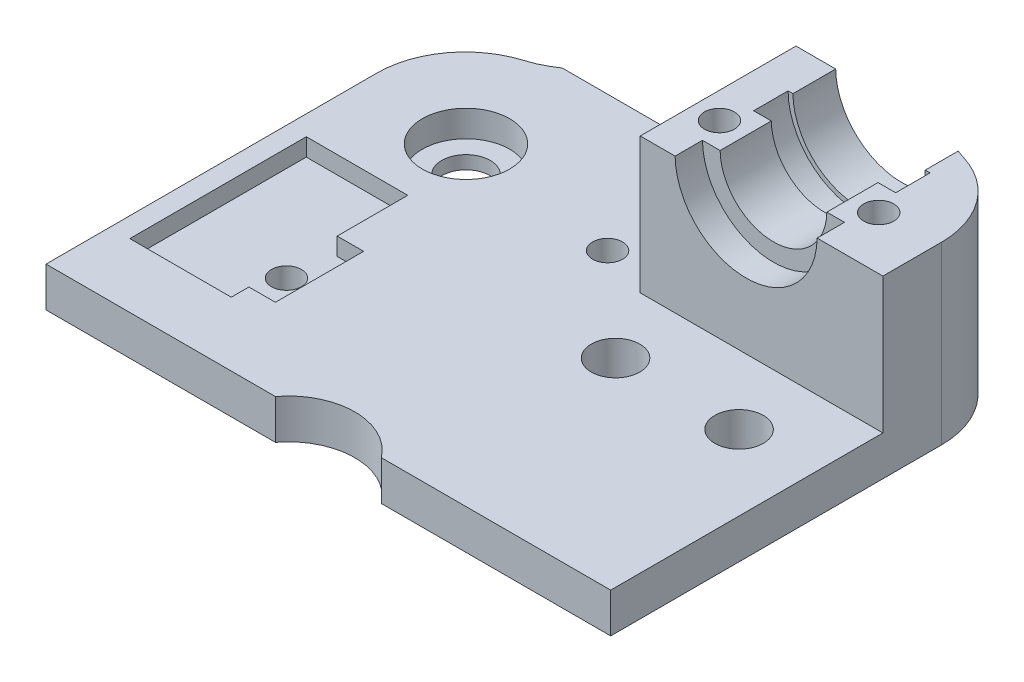
from build123d import *

# Parameters (mm, degrees)
SKETCH4_R           = 4.95
SKETCH4_R_2         = 2.75
SKETCH4_R_3         = 1.7
BOSS_EXTRUDE1_DEPTH = 4.5
BOSS_EXTRUDE2_START = 2.85
SKETCH4_2_R         = 4.95
BOSS_EXTRUDE2_DEPTH = 1.65
BOSS_EXTRUDE3_DEPTH = 15.5
CUT_EXTRUDE1_DEPTH  = 3.85
CUT_EXTRUDE2_START  = -3.85
SKETCH7_3_R         = 8.05
CUT_EXTRUDE2_DEPTH  = 3.9
CUT_EXTRUDE4_START  = -7.75
CUT_EXTRUDE4_DEPTH  = 5.8
CUT_EXTRUDE5_START  = -13.55
SKETCH7_5_R         = 8.05
CUT_EXTRUDE5_DEPTH  = 3.1
SKETCH8_W           = 24
SKETCH8_H           = 16.65
CUT_EXTRUDE6_DEPTH  = 0.1
SKETCH9_R           = 1.7
CUT_EXTRUDE7_DEPTH  = 83.1477938
SKETCH13_R          = 4.95
SKETCH13_R_2        = 2.75
BOSS_EXTRUDE5_DEPTH = 1.5
CUT_EXTRUDE12_START = -8
SKETCH14_R          = 1.7
CUT_EXTRUDE12_DEPTH = 8
CUT_EXTRUDE13_START = -8.2
CUT_EXTRUDE13_DEPTH = 0.2
CUT_EXTRUDE14_START = -8.4
CUT_EXTRUDE14_DEPTH = 0.2
BOSS_EXTRUDE6_DEPTH = 15.4
BOSS_EXTRUDE8_START = 1
BOSS_EXTRUDE8_DEPTH = 1
FILLET1_R           = 10
CUT_EXTRUDE15_START = -2
SKETCH18_R          = 1.7
SKETCH18_W          = 11.5
SKETCH18_H          = 20
CUT_EXTRUDE15_DEPTH = 2
CUT_EXTRUDE16_START = -4.85
SKETCH19_R          = 7.5
CUT_EXTRUDE16_DEPTH = 4.85


with BuildPart() as part:
    # Sketch4 → Boss-Extrude1 (new body)
    with BuildSketch(Plane(origin=(0, 0, 0), x_dir=(1, 0, 0), z_dir=(0, 1, 0))):
        with BuildLine():
            Line((0, 0), (26, 0))
            ThreePointArc((26, 0), (32, 3), (38, 0))
            Line((38, 0), (64, 0))
            Line((64, 0), (64, 37.5))
            ThreePointArc((64, 37.5), (61.071067812, 44.571067812), (54, 47.5))
            Line((54, 47.5), (10, 47.5))
            ThreePointArc((10, 47.5), (2.928932188, 44.571067812), (0, 37.5))
            Line((0, 37.5), (0, 0))
        make_face()
        with Locations(Location((12, 35.6, 0), (0, 0, 270))):
            Circle(SKETCH4_R, mode=Mode.SUBTRACT)
        with Locations(Location((52, 35.6, 0), (0, 0, 270))):
            Circle(SKETCH4_R, mode=Mode.SUBTRACT)
        with Locations(Location((41.5, 23.05, 0), (0, 0, 270))):
            Circle(SKETCH4_R_2, mode=Mode.SUBTRACT)
        with Locations(Location((55.5, 23.05, 0), (0, 0, 270))):
            Circle(SKETCH4_R_2, mode=Mode.SUBTRACT)
        with Locations(Location((13, 14.25, 0), (0, 0, 270))):
            Circle(SKETCH4_R_3, mode=Mode.SUBTRACT)
        with Locations(Location((30.5, 33.15, 0), (0, 0, 270))):
            Circle(SKETCH4_R_3, mode=Mode.SUBTRACT)
    extrude(amount=BOSS_EXTRUDE1_DEPTH)

    # Sketch4<2> → Boss-Extrude2 (add)
    with BuildSketch(Plane(origin=(0, 0, 0), x_dir=(1, 0, 0), z_dir=(0, 1, 0)).offset(BOSS_EXTRUDE2_START)):
        with Locations(Location((52, 35.6, 0), (0, 0, 270))):
            Circle(SKETCH4_2_R)
    extrude(amount=BOSS_EXTRUDE2_DEPTH)

    # Sketch6 → Boss-Extrude3 (add)
    with BuildSketch(Plane(origin=(0, 4.5, 0), x_dir=(1, 0, 0), z_dir=(0, 1, 0))):
        with BuildLine():
            Line((36.5, 47.5), (54, 47.5))
            ThreePointArc((54, 47.5), (57.464576398, 46.880656181), (60.5, 45.099342077))
            Line((60.5, 45.099342077), (60.5, 30.85))
            Line((60.5, 30.85), (36.5, 30.85))
            Line((36.5, 30.85), (36.5, 47.5))
        make_face()
    extrude(amount=BOSS_EXTRUDE3_DEPTH)

    # Sketch7 → Cut-Extrude1 (cut)
    with BuildSketch(Plane(origin=(0, 0, -47.5), x_dir=(-1, 0, 0), z_dir=(0, 0, -1))):
        with BuildLine():
            Line((-42.45, 20), (-54, 20))
            Line((-54, 20), (-54, 17.479583368))
            ThreePointArc((-54, 17.479583368), (-47.210135666, 14.089099053), (-42.45, 20))
        make_face()
        with BuildLine():
            Line((-54, 17.479583368), (-54, 20))
            Line((-54, 20), (-54.55, 20))
            ThreePointArc((-54.55, 20), (-54.410900947, 18.710135666), (-54, 17.479583368))
        make_face()
        with BuildLine():
            Line((-42.45, 20), (-54, 20))
            Line((-54, 20), (-54, 17.479583368))
            ThreePointArc((-54, 17.479583368), (-47.210135666, 14.089099053), (-42.45, 20))
        make_face()
    extrude(amount=-CUT_EXTRUDE1_DEPTH, mode=Mode.SUBTRACT)

    # Sketch7<3> → Cut-Extrude2 (cut)
    with BuildSketch(Plane(origin=(0, 0, -47.5), x_dir=(-1, 0, 0), z_dir=(0, 0, -1)).offset(CUT_EXTRUDE2_START)):
        with Locations((-48.5, 20)):
            Circle(SKETCH7_3_R)
    extrude(amount=-CUT_EXTRUDE2_DEPTH, mode=Mode.SUBTRACT)

    # Sketch7<4> → Cut-Extrude4 (cut)
    with BuildSketch(Plane(origin=(0, 0, -47.5), x_dir=(-1, 0, 0), z_dir=(0, 0, -1)).offset(CUT_EXTRUDE4_START)):
        with BuildLine():
            Line((-42.45, 20), (-54, 20))
            Line((-54, 20), (-54, 17.479583368))
            ThreePointArc((-54, 17.479583368), (-47.210135666, 14.089099053), (-42.45, 20))
        make_face()
        with BuildLine():
            Line((-54, 17.479583368), (-54, 20))
            Line((-54, 20), (-54.55, 20))
            ThreePointArc((-54.55, 20), (-54.410900947, 18.710135666), (-54, 17.479583368))
        make_face()
        with BuildLine():
            Line((-42.45, 20), (-54, 20))
            Line((-54, 20), (-54, 17.479583368))
            ThreePointArc((-54, 17.479583368), (-47.210135666, 14.089099053), (-42.45, 20))
        make_face()
    extrude(amount=-CUT_EXTRUDE4_DEPTH, mode=Mode.SUBTRACT)

    # Sketch7<5> → Cut-Extrude5 (cut)
    with BuildSketch(Plane(origin=(0, 0, -47.5), x_dir=(-1, 0, 0), z_dir=(0, 0, -1)).offset(CUT_EXTRUDE5_START)):
        with Locations((-48.5, 20)):
            Circle(SKETCH7_5_R)
    extrude(amount=-CUT_EXTRUDE5_DEPTH, mode=Mode.SUBTRACT)

    # Sketch8 → Cut-Extrude6 (cut)
    with BuildSketch(Plane(origin=(0, 20, 0), x_dir=(1, 0, 0), z_dir=(0, 1, 0))):
        with Locations((48.5, 39.175)):
            Rectangle(SKETCH8_W, SKETCH8_H)
    extrude(amount=-CUT_EXTRUDE6_DEPTH, mode=Mode.SUBTRACT)

    # Sketch9 → Cut-Extrude7 (cut, through all)
    with BuildSketch(Plane(origin=(0, 19.9, 0), x_dir=(1, 0, 0), z_dir=(0, 1, 0))):
        with Locations(Location((39.475413251, 36.85, 0), (0, 0, 270))):
            Circle(SKETCH9_R)
        with Locations(Location((57.524586749, 36.85, 0), (0, 0, 270))):
            Circle(SKETCH9_R)
    extrude(amount=-CUT_EXTRUDE7_DEPTH, mode=Mode.SUBTRACT)

    # Sketch13 → Boss-Extrude5 (add)
    with BuildSketch(Plane.XZ):
        with Locations(Location((12, -35.6, 0), (0, 0, 270))):
            Circle(SKETCH13_R)
        with Locations(Location((12, -35.6, 0), (0, 0, 270))):
            Circle(SKETCH13_R_2, mode=Mode.SUBTRACT)
    extrude(amount=-BOSS_EXTRUDE5_DEPTH)

    # Sketch14 → Cut-Extrude12 (cut)
    with BuildSketch(Plane.XZ.offset(CUT_EXTRUDE12_START)):
        with Locations(Location((39.475413251, -36.85, 0), (0, 0, 90))):
            Circle(SKETCH14_R)
        Polygon((41.175413251, -35.15), (41.175413251, -34.656068977), (39.475413251, -33.674573519), (37.775413251, -34.656068977), (37.775413251, -35.15), (39.475413251, -35.15), align=None)
        with BuildLine():
            Line((41.175413251, -36.85), (41.175413251, -35.15))
            Line((41.175413251, -35.15), (39.475413251, -35.15))
            ThreePointArc((39.475413251, -35.15), (40.677494779, -35.647918472), (41.175413251, -36.85))
        make_face()
        Polygon((41.175413251, -35.15), (42.030926879, -35.15), (41.175413251, -34.656068977), align=None)
        Polygon((42.030926879, -38.55), (42.225413251, -38.43771324), (42.225413251, -35.26228676), (42.030926879, -35.15), (41.175413251, -35.15), (41.175413251, -36.85), (41.175413251, -38.55), align=None)
        Polygon((41.175413251, -39.043931023), (42.030926879, -38.55), (41.175413251, -38.55), align=None)
        Polygon((39.475413251, -40.025426481), (41.175413251, -39.043931023), (41.175413251, -38.55), (39.475413251, -38.55), (37.775413251, -38.55), (37.775413251, -39.043931023), align=None)
        with BuildLine():
            Line((39.475413251, -38.55), (41.175413251, -38.55))
            Line((41.175413251, -38.55), (41.175413251, -36.85))
            ThreePointArc((41.175413251, -36.85), (40.677494779, -38.052081528), (39.475413251, -38.55))
        make_face()
        with BuildLine():
            Line((37.775413251, -38.55), (39.475413251, -38.55))
            ThreePointArc((39.475413251, -38.55), (38.273331723, -38.052081528), (37.775413251, -36.85))
            Line((37.775413251, -36.85), (37.775413251, -38.55))
        make_face()
        Polygon((36.919899624, -38.55), (37.775413251, -39.043931023), (37.775413251, -38.55), align=None)
        Polygon((36.919899624, -38.55), (37.775413251, -38.55), (37.775413251, -36.85), (37.775413251, -35.15), (36.919899624, -35.15), (36.725413251, -35.26228676), (36.725413251, -38.43771324), align=None)
        Polygon((37.775413251, -35.15), (37.775413251, -34.656068977), (36.919899624, -35.15), align=None)
        with BuildLine():
            ThreePointArc((37.775413251, -36.85), (38.273331723, -35.647918472), (39.475413251, -35.15))
            Line((39.475413251, -35.15), (37.775413251, -35.15))
            Line((37.775413251, -35.15), (37.775413251, -36.85))
        make_face()
        with BuildLine():
            Line((57.524586749, -40.025426481), (59.224586749, -39.043931023))
            Line((59.224586749, -39.043931023), (59.224586749, -38.55))
            Line((59.224586749, -38.55), (57.524586749, -38.55))
            Line((57.524586749, -38.55), (55.974921383, -38.55))
            ThreePointArc((55.974921383, -38.55), (55.90094113, -38.647155772), (55.824586749, -38.742457033))
            Line((55.824586749, -38.742457033), (55.824586749, -39.043931023))
            Line((55.824586749, -39.043931023), (57.524586749, -40.025426481))
        make_face()
        Polygon((59.224586749, -39.043931023), (60.080100376, -38.55), (59.224586749, -38.55), align=None)
        Polygon((60.080100376, -38.55), (60.274586749, -38.43771324), (60.274586749, -35.26228676), (60.080100376, -35.15), (59.224586749, -35.15), (59.224586749, -36.85), (59.224586749, -38.55), align=None)
        with BuildLine():
            Line((57.524586749, -38.55), (59.224586749, -38.55))
            Line((59.224586749, -38.55), (59.224586749, -36.85))
            ThreePointArc((59.224586749, -36.85), (58.726668277, -38.052081528), (57.524586749, -38.55))
        make_face()
        with BuildLine():
            Line((55.974921383, -38.55), (57.524586749, -38.55))
            ThreePointArc((57.524586749, -38.55), (56.864634759, -38.416672707), (56.308199961, -38.037603967))
            ThreePointArc((56.308199961, -38.037603967), (56.149477343, -38.298951237), (55.974921383, -38.55))
        make_face()
        with BuildLine():
            ThreePointArc((57.524586749, -38.55), (58.726668277, -38.052081528), (59.224586749, -36.85))
            ThreePointArc((59.224586749, -36.85), (58.726668283, -35.647918478), (57.524586766, -35.15))
            ThreePointArc((57.524586766, -35.15), (57.226643414, -35.176312523), (56.937923169, -35.254435572))
            ThreePointArc((56.937923169, -35.254435572), (56.933989419, -35.202195507), (56.929503018, -35.15))
            Line((56.929503018, -35.15), (55.824586749, -35.15))
            Line((55.824586749, -35.15), (55.824586749, -38.55))
            Line((55.824586749, -38.55), (55.974921383, -38.55))
            ThreePointArc((55.974921383, -38.55), (56.149477343, -38.298951237), (56.308199961, -38.037603967))
            ThreePointArc((56.308199961, -38.037603967), (56.864634759, -38.416672707), (57.524586749, -38.55))
        make_face()
        with BuildLine():
            ThreePointArc((55.824586749, -38.742457033), (55.90094113, -38.647155772), (55.974921383, -38.55))
            Line((55.974921383, -38.55), (55.824586749, -38.55))
            Line((55.824586749, -38.55), (55.824586749, -38.742457033))
        make_face()
        with BuildLine():
            Line((54.969073121, -38.55), (55.650309982, -38.943312285))
            ThreePointArc((55.650309982, -38.943312285), (55.738797399, -38.84405518), (55.824586749, -38.742457033))
            Line((55.824586749, -38.742457033), (55.824586749, -38.55))
            Line((55.824586749, -38.55), (54.969073121, -38.55))
        make_face()
        Polygon((54.969073121, -38.55), (55.824586749, -38.55), (55.824586749, -35.15), (54.969073121, -35.15), (54.774586749, -35.26228676), (54.774586749, -38.43771324), align=None)
        Polygon((55.824586749, -35.15), (55.824586749, -34.656068977), (54.969073121, -35.15), align=None)
        with BuildLine():
            ThreePointArc((56.929503018, -35.15), (56.855411043, -34.636940496), (56.728069624, -34.134442896))
            Line((56.728069624, -34.134442896), (55.824586749, -34.656068977))
            Line((55.824586749, -34.656068977), (55.824586749, -35.15))
            Line((55.824586749, -35.15), (56.929503018, -35.15))
        make_face()
        with BuildLine():
            ThreePointArc((56.937923169, -35.254435572), (57.226643414, -35.176312523), (57.524586766, -35.15))
            Line((57.524586766, -35.15), (56.929503018, -35.15))
            ThreePointArc((56.929503018, -35.15), (56.933989419, -35.202195507), (56.937923169, -35.254435572))
        make_face()
        with BuildLine():
            Line((59.224586749, -35.15), (59.224586749, -34.656068977))
            Line((59.224586749, -34.656068977), (57.524586749, -33.674573519))
            Line((57.524586749, -33.674573519), (56.728069624, -34.134442896))
            ThreePointArc((56.728069624, -34.134442896), (56.855411043, -34.636940496), (56.929503018, -35.15))
            Line((56.929503018, -35.15), (57.524586766, -35.15))
            Line((57.524586766, -35.15), (59.224586749, -35.15))
        make_face()
        with BuildLine():
            Line((59.224586749, -36.85), (59.224586749, -35.15))
            Line((59.224586749, -35.15), (57.524586766, -35.15))
            ThreePointArc((57.524586766, -35.15), (58.726668283, -35.647918478), (59.224586749, -36.85))
        make_face()
        Polygon((59.224586749, -35.15), (60.080100376, -35.15), (59.224586749, -34.656068977), align=None)
        with BuildLine():
            Line((55.650309982, -38.943312285), (55.824586749, -39.043931023))
            Line((55.824586749, -39.043931023), (55.824586749, -38.742457033))
            ThreePointArc((55.824586749, -38.742457033), (55.738797399, -38.84405518), (55.650309982, -38.943312285))
        make_face()
    extrude(amount=CUT_EXTRUDE12_DEPTH, mode=Mode.SUBTRACT)

    # Sketch14<3> → Cut-Extrude13 (cut)
    with BuildSketch(Plane.XZ.offset(CUT_EXTRUDE13_START)):
        Polygon((36.919899624, -38.55), (37.775413251, -38.55), (37.775413251, -36.85), (37.775413251, -35.15), (36.919899624, -35.15), (36.725413251, -35.26228676), (36.725413251, -38.43771324), align=None)
        with BuildLine():
            ThreePointArc((37.775413251, -36.85), (38.273331723, -35.647918472), (39.475413251, -35.15))
            Line((39.475413251, -35.15), (37.775413251, -35.15))
            Line((37.775413251, -35.15), (37.775413251, -36.85))
        make_face()
        with BuildLine():
            Line((41.175413251, -36.85), (41.175413251, -35.15))
            Line((41.175413251, -35.15), (39.475413251, -35.15))
            ThreePointArc((39.475413251, -35.15), (40.677494779, -35.647918472), (41.175413251, -36.85))
        make_face()
        Polygon((42.030926879, -38.55), (42.225413251, -38.43771324), (42.225413251, -35.26228676), (42.030926879, -35.15), (41.175413251, -35.15), (41.175413251, -36.85), (41.175413251, -38.55), align=None)
        with BuildLine():
            Line((39.475413251, -38.55), (41.175413251, -38.55))
            Line((41.175413251, -38.55), (41.175413251, -36.85))
            ThreePointArc((41.175413251, -36.85), (40.677494779, -38.052081528), (39.475413251, -38.55))
        make_face()
        with BuildLine():
            Line((37.775413251, -38.55), (39.475413251, -38.55))
            ThreePointArc((39.475413251, -38.55), (38.273331723, -38.052081528), (37.775413251, -36.85))
            Line((37.775413251, -36.85), (37.775413251, -38.55))
        make_face()
        Polygon((54.969073121, -38.55), (55.824586749, -38.55), (55.824586749, -35.15), (54.969073121, -35.15), (54.774586749, -35.26228676), (54.774586749, -38.43771324), align=None)
        with BuildLine():
            ThreePointArc((57.524586749, -38.55), (58.726668277, -38.052081528), (59.224586749, -36.85))
            ThreePointArc((59.224586749, -36.85), (58.726668283, -35.647918478), (57.524586766, -35.15))
            ThreePointArc((57.524586766, -35.15), (57.226643414, -35.176312523), (56.937923169, -35.254435572))
            ThreePointArc((56.937923169, -35.254435572), (56.933989419, -35.202195507), (56.929503018, -35.15))
            Line((56.929503018, -35.15), (55.824586749, -35.15))
            Line((55.824586749, -35.15), (55.824586749, -38.55))
            Line((55.824586749, -38.55), (55.974921383, -38.55))
            ThreePointArc((55.974921383, -38.55), (56.149477343, -38.298951237), (56.308199961, -38.037603967))
            ThreePointArc((56.308199961, -38.037603967), (56.864634759, -38.416672707), (57.524586749, -38.55))
        make_face()
        with BuildLine():
            ThreePointArc((56.937923169, -35.254435572), (57.226643414, -35.176312523), (57.524586766, -35.15))
            Line((57.524586766, -35.15), (56.929503018, -35.15))
            ThreePointArc((56.929503018, -35.15), (56.933989419, -35.202195507), (56.937923169, -35.254435572))
        make_face()
        with BuildLine():
            Line((59.224586749, -36.85), (59.224586749, -35.15))
            Line((59.224586749, -35.15), (57.524586766, -35.15))
            ThreePointArc((57.524586766, -35.15), (58.726668283, -35.647918478), (59.224586749, -36.85))
        make_face()
        with BuildLine():
            Line((57.524586749, -38.55), (59.224586749, -38.55))
            Line((59.224586749, -38.55), (59.224586749, -36.85))
            ThreePointArc((59.224586749, -36.85), (58.726668277, -38.052081528), (57.524586749, -38.55))
        make_face()
        with BuildLine():
            Line((55.974921383, -38.55), (57.524586749, -38.55))
            ThreePointArc((57.524586749, -38.55), (56.864634759, -38.416672707), (56.308199961, -38.037603967))
            ThreePointArc((56.308199961, -38.037603967), (56.149477343, -38.298951237), (55.974921383, -38.55))
        make_face()
        Polygon((60.080100376, -38.55), (60.274586749, -38.43771324), (60.274586749, -35.26228676), (60.080100376, -35.15), (59.224586749, -35.15), (59.224586749, -36.85), (59.224586749, -38.55), align=None)
    extrude(amount=CUT_EXTRUDE13_DEPTH, mode=Mode.SUBTRACT)

    # Sketch14<4> → Cut-Extrude14 (cut)
    with BuildSketch(Plane.XZ.offset(CUT_EXTRUDE14_START)):
        Polygon((41.175413251, -35.15), (41.175413251, -34.656068977), (39.475413251, -33.674573519), (37.775413251, -34.656068977), (37.775413251, -35.15), (39.475413251, -35.15), align=None)
        with BuildLine():
            ThreePointArc((37.775413251, -36.85), (38.273331723, -35.647918472), (39.475413251, -35.15))
            Line((39.475413251, -35.15), (37.775413251, -35.15))
            Line((37.775413251, -35.15), (37.775413251, -36.85))
        make_face()
        with BuildLine():
            Line((41.175413251, -36.85), (41.175413251, -35.15))
            Line((41.175413251, -35.15), (39.475413251, -35.15))
            ThreePointArc((39.475413251, -35.15), (40.677494779, -35.647918472), (41.175413251, -36.85))
        make_face()
        with BuildLine():
            Line((39.475413251, -38.55), (41.175413251, -38.55))
            Line((41.175413251, -38.55), (41.175413251, -36.85))
            ThreePointArc((41.175413251, -36.85), (40.677494779, -38.052081528), (39.475413251, -38.55))
        make_face()
        with BuildLine():
            Line((37.775413251, -38.55), (39.475413251, -38.55))
            ThreePointArc((39.475413251, -38.55), (38.273331723, -38.052081528), (37.775413251, -36.85))
            Line((37.775413251, -36.85), (37.775413251, -38.55))
        make_face()
        Polygon((39.475413251, -40.025426481), (41.175413251, -39.043931023), (41.175413251, -38.55), (39.475413251, -38.55), (37.775413251, -38.55), (37.775413251, -39.043931023), align=None)
        with BuildLine():
            Line((57.524586749, -40.025426481), (59.224586749, -39.043931023))
            Line((59.224586749, -39.043931023), (59.224586749, -38.55))
            Line((59.224586749, -38.55), (57.524586749, -38.55))
            Line((57.524586749, -38.55), (55.974921383, -38.55))
            ThreePointArc((55.974921383, -38.55), (55.90094113, -38.647155772), (55.824586749, -38.742457033))
            Line((55.824586749, -38.742457033), (55.824586749, -39.043931023))
            Line((55.824586749, -39.043931023), (57.524586749, -40.025426481))
        make_face()
        with BuildLine():
            ThreePointArc((55.824586749, -38.742457033), (55.90094113, -38.647155772), (55.974921383, -38.55))
            Line((55.974921383, -38.55), (55.824586749, -38.55))
            Line((55.824586749, -38.55), (55.824586749, -38.742457033))
        make_face()
        with BuildLine():
            ThreePointArc((57.524586749, -38.55), (58.726668277, -38.052081528), (59.224586749, -36.85))
            ThreePointArc((59.224586749, -36.85), (58.726668283, -35.647918478), (57.524586766, -35.15))
            ThreePointArc((57.524586766, -35.15), (57.226643414, -35.176312523), (56.937923169, -35.254435572))
            ThreePointArc((56.937923169, -35.254435572), (56.933989419, -35.202195507), (56.929503018, -35.15))
            Line((56.929503018, -35.15), (55.824586749, -35.15))
            Line((55.824586749, -35.15), (55.824586749, -38.55))
            Line((55.824586749, -38.55), (55.974921383, -38.55))
            ThreePointArc((55.974921383, -38.55), (56.149477343, -38.298951237), (56.308199961, -38.037603967))
            ThreePointArc((56.308199961, -38.037603967), (56.864634759, -38.416672707), (57.524586749, -38.55))
        make_face()
        with BuildLine():
            Line((57.524586749, -38.55), (59.224586749, -38.55))
            Line((59.224586749, -38.55), (59.224586749, -36.85))
            ThreePointArc((59.224586749, -36.85), (58.726668277, -38.052081528), (57.524586749, -38.55))
        make_face()
        with BuildLine():
            Line((55.974921383, -38.55), (57.524586749, -38.55))
            ThreePointArc((57.524586749, -38.55), (56.864634759, -38.416672707), (56.308199961, -38.037603967))
            ThreePointArc((56.308199961, -38.037603967), (56.149477343, -38.298951237), (55.974921383, -38.55))
        make_face()
        with BuildLine():
            ThreePointArc((56.937923169, -35.254435572), (57.226643414, -35.176312523), (57.524586766, -35.15))
            Line((57.524586766, -35.15), (56.929503018, -35.15))
            ThreePointArc((56.929503018, -35.15), (56.933989419, -35.202195507), (56.937923169, -35.254435572))
        make_face()
        with BuildLine():
            Line((59.224586749, -36.85), (59.224586749, -35.15))
            Line((59.224586749, -35.15), (57.524586766, -35.15))
            ThreePointArc((57.524586766, -35.15), (58.726668283, -35.647918478), (59.224586749, -36.85))
        make_face()
        with BuildLine():
            Line((59.224586749, -35.15), (59.224586749, -34.656068977))
            Line((59.224586749, -34.656068977), (57.524586749, -33.674573519))
            Line((57.524586749, -33.674573519), (56.728069624, -34.134442896))
            ThreePointArc((56.728069624, -34.134442896), (56.855411043, -34.636940496), (56.929503018, -35.15))
            Line((56.929503018, -35.15), (57.524586766, -35.15))
            Line((57.524586766, -35.15), (59.224586749, -35.15))
        make_face()
        with BuildLine():
            ThreePointArc((56.929503018, -35.15), (56.855411043, -34.636940496), (56.728069624, -34.134442896))
            Line((56.728069624, -34.134442896), (55.824586749, -34.656068977))
            Line((55.824586749, -34.656068977), (55.824586749, -35.15))
            Line((55.824586749, -35.15), (56.929503018, -35.15))
        make_face()
    extrude(amount=CUT_EXTRUDE14_DEPTH, mode=Mode.SUBTRACT)

    # Sketch15 → Boss-Extrude6 (add)
    with BuildSketch(Plane(origin=(0, 4.5, 0), x_dir=(1, 0, 0), z_dir=(0, 1, 0))):
        with BuildLine():
            Line((60.5, 30.85), (64, 30.85))
            Line((64, 30.85), (64, 37.5))
            ThreePointArc((64, 37.5), (63.082951062, 41.683300133), (60.5, 45.099342077))
            Line((60.5, 45.099342077), (60.5, 30.85))
        make_face()
    extrude(amount=BOSS_EXTRUDE6_DEPTH)

    # Sketch17 → Boss-Extrude8 (add)
    with BuildSketch(Plane(origin=(0, 0, -47.5), x_dir=(-1, 0, 0), z_dir=(0, 0, -1)).offset(BOSS_EXTRUDE8_START)):
        with BuildLine():
            Line((-36.5, 19.9), (-42.450826503, 19.9))
            ThreePointArc((-42.450826503, 19.9), (-47.259031809, 14.078640532), (-54, 17.479583368))
            Line((-54, 17.479583368), (-54, 0))
            Line((-54, 0), (-10, 0))
            Line((-10, 0), (-10, 4.5))
            Line((-10, 4.5), (-36.5, 4.5))
            Line((-36.5, 4.5), (-36.5, 19.9))
        make_face()
    extrude(amount=-BOSS_EXTRUDE8_DEPTH)

    # Fillet1
    # the kernel refuses this fillet: 10 mm, written as the material it adds along each edge
    with BuildSketch(Plane(origin=(10, 0, -47.5), x_dir=(0, 0, -1), z_dir=(0, 1, 0))) as fillet1_piece_1:
        with BuildLine():
            CenterArc((9.136363636, 5.813741203), FILLET1_R, 196.899093783, 18.648155306)
            Line((-0.431818182, 2.906870602), (-0.623181818, 2.84873319))
            ThreePointArc((-0.623181818, 2.84873319), (-0.306372759, 1.439996843), (-0.2, 0))
            Line((-0.2, 0), (0, -0.2))
            ThreePointArc((0, -0.2), (0.5, -0.2), (0.837272727, -0.116274824))
            Line((0.837272727, -0.116274824), (1, 0))
        make_face()
    extrude(amount=4.5)
    with BuildSketch(Plane(origin=(54, 24.826506038, -47.5), x_dir=(0, 0, -1), z_dir=(0, -1, 0))) as fillet1_piece_2_section:
        with BuildLine():
            CenterArc((9.136363636, 5.813741203), FILLET1_R, 196.899093783, 18.648155306)
            Line((-0.431818182, 2.906870602), (-0.623181818, 2.84873319))
            ThreePointArc((-0.623181818, 2.84873319), (-0.306372759, 1.439996843), (-0.2, 0))
            Line((-0.2, 0), (0, -0.2))
            ThreePointArc((0, -0.2), (0.5, -0.2), (0.837272727, -0.116274824))
            Line((0.837272727, -0.116274824), (1, 0))
        make_face()
    fillet1_piece_2 = extrude(amount=24.826506038, mode=Mode.PRIVATE)
    fillet1_piece_2 = fillet1_piece_2 - Plane(origin=(48.5, 20, -47.589405223), x_dir=(0.9090909090908866, -0.41659779045058, 0), z_dir=(0, 0, -1)) * Cylinder(6.05, 62, mode=Mode.PRIVATE)
    fillet1_piece_2 = split(fillet1_piece_2, bisect_by=Plane(origin=(54.911060016, 19.9, -47.589405223), z_dir=(0, -1, 0)), keep=Keep.TOP, mode=Mode.PRIVATE)
    add(fillet1_piece_2)

    # Sketch18 → Cut-Extrude15 (cut)
    with BuildSketch(Plane(origin=(0, 4.5, 0), x_dir=(1, 0, 0), z_dir=(0, 1, 0)).offset(CUT_EXTRUDE15_START)):
        with Locations(Location((13, 14.25, 0), (0, 0, 270))):
            Circle(SKETCH18_R)
        with Locations((8, 17.25)):
            Rectangle(SKETCH18_W, SKETCH18_H)
        with BuildLine():
            Line((16.75, 19.25), (13.75, 19.25))
            Line((13.75, 19.25), (13.75, 15.77561463))
            ThreePointArc((13.75, 15.77561463), (14.443086969, 15.148610038), (14.7, 14.25))
            ThreePointArc((14.7, 14.25), (14.443086969, 13.351389962), (13.75, 12.72438537))
            Line((13.75, 12.72438537), (13.75, 9.25))
            Line((13.75, 9.25), (16.75, 9.25))
            Line((16.75, 9.25), (16.75, 19.25))
        make_face()
    extrude(amount=CUT_EXTRUDE15_DEPTH, mode=Mode.SUBTRACT)

    # Sketch19 → Cut-Extrude16 (cut)
    with BuildSketch(Plane(origin=(0, 0, -48.5), x_dir=(-1, 0, 0), z_dir=(0, 0, -1)).offset(CUT_EXTRUDE16_START)):
        with Locations((-48.5, 20)):
            Circle(SKETCH19_R)
    extrude(amount=CUT_EXTRUDE16_DEPTH, mode=Mode.SUBTRACT)


solid = part.part
